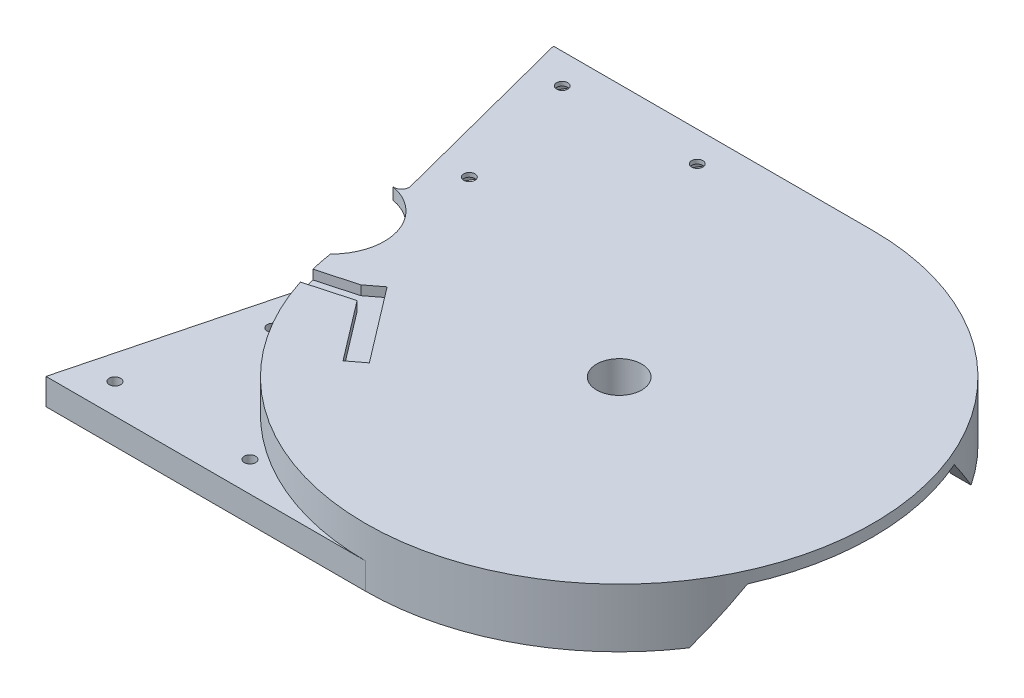
from build123d import *
from build123d.topology import SkipClean

# Parameters (mm, degrees)
SALIENTE_EXTRUIR4_DEPTH      = 8.6
SALIENTE_EXTRUIR2_DEPTH      = 23
CORTAR_EXTRUIR1_DEPTH        = 174.347194959
CORTAR_EXTRUIR1_DEPTH_BACK   = 174.347194959
CROQUIS2_R                   = 14
CROQUIS2_R_2                 = 24
CROQUIS5_R                   = 2.5
CORTAR_EXTRUIR2_DEPTH        = 175.696336539
SALIENTE_EXTRUIR3_START      = -15.6
SALIENTE_EXTRUIR3_DEPTH      = 15.6
CORTAR_EXTRUIR3_DEPTH        = 174.347194959
CORTAR_EXTRUIR3_DEPTH_BACK   = 174.347194959
CROQUIS7_R                   = 6
CORTAR_EXTRUIR4_DEPTH        = 5
CORTAR_EXTRUIR4_DEPTH_BACK   = 12.5
REDONDEO1_R                  = 2
CROQUIS9_R                   = 16.85
CROQUIS9_R_2                 = 6
SALIENTE_EXTRUIR5_DEPTH      = 4.65
CROQUIS10_R                  = 10
CROQUIS10_R_2                = 6
SALIENTE_EXTRUIR6_DEPTH      = 29
REDONDEO2_R                  = 0.5
REDONDEO3_R                  = 2
SALIENTE_EXTRUIR7_REACH      = 177.079
CROQUIS12_R                  = 1.5
CORTAR_EXTRUIR5_DEPTH        = 174.111445318
CORTAR_EXTRUIR6_DEPTH        = 2
CROQUIS14_R                  = 3
CORTAR_EXTRUIR7_DEPTH        = 3.7
CROQUIS15_R                  = 2
CORTAR_EXTRUIR8_DEPTH        = 175.696336539
CROQUIS16_R                  = 4
CORTAR_EXTRUIR9_DEPTH        = 4
CORTAR_EXTRUIR10_DEPTH       = 10
CORTAR_EXTRUIR11_DEPTH       = 2.5
CROQUIS20_W                  = 12
CROQUIS20_H                  = 5
CORTAR_EXTRUIR12_DEPTH       = 176.700917755
REDONDEO4_R                  = 5
CORTAR_EXTRUIR13_START       = -31.6
CORTAR_EXTRUIR13_OUTLINE_W   = 12
CORTAR_EXTRUIR13_OUTLINE_H   = 5
CORTAR_EXTRUIR13_OUTLINE_R   = 2.5
CORTAR_EXTRUIR13_OUTLINE_R_2 = 24
CORTAR_EXTRUIR13_OUTLINE_R_3 = 2
CORTAR_EXTRUIR13_DEPTH       = 31.6
CORTAR_EXTRUIR14_DEPTH       = 8.6
CORTAR_EXTRUIR15_START       = 30
CORTAR_EXTRUIR15_DEPTH       = 83.132388274


# Read off the part's stored shape, not the designer's step: Cortar-Extruir13
with BuildPart() as part:
    # Croquis1 → Saliente-Extruir4 (new body)
    with BuildSketch(Plane(origin=(0, 0, 0), x_dir=(1, 0, 0), z_dir=(0, 1, 0))):
        with BuildLine():
            Line((0, -67.5), (-158, -67.5))
            Line((-158, -67.5), (-158, 67.5))
            Line((-158, 67.5), (0, 67.5))
            ThreePointArc((0, 67.5), (67.5, 0), (0, -67.5))
        make_face()
    extrude(amount=SALIENTE_EXTRUIR4_DEPTH)

    # Croquis3 → Saliente-Extruir2 (add)
    with BuildSketch(Plane.XZ):
        Polygon((-85, -67.5), (-68.148148148, -2.5), (-158, -2.5), (-158, -67.5), align=None)
    extrude(amount=SALIENTE_EXTRUIR2_DEPTH)

    # Croquis2 → Cortar-Extruir1 (cut, two sides: drawn at the far end of the back side and taken through both)
    with BuildSketch(Plane(origin=(0, 0, 0), x_dir=(1, 0, 0), z_dir=(0, 1, 0)).offset(-CORTAR_EXTRUIR1_DEPTH_BACK)):
        with Locations(Location((-76.5, 0, 0), (0, 0, 66.051358792))):
            Circle(CROQUIS2_R)
        with Locations(Location((-121.5, 31, 0), (0, 0, 90))):
            Circle(CROQUIS2_R_2)
        with Locations(Location((-121.5, -31, 0), (0, 0, 90))):
            Circle(CROQUIS2_R_2)
    extrude(amount=CORTAR_EXTRUIR1_DEPTH + CORTAR_EXTRUIR1_DEPTH_BACK, mode=Mode.SUBTRACT)

    # Croquis5 → Cortar-Extruir2 (cut, through all)
    with BuildSketch(Plane(origin=(0, 8.6, 0), x_dir=(1, 0, 0), z_dir=(0, 1, 0))):
        with Locations(Location((-145, -7.5, 0), (0, 0, 270))):
            Circle(CROQUIS5_R)
        with Locations(Location((-145, -54.5, 0), (0, 0, 270))):
            Circle(CROQUIS5_R)
        with Locations(Location((-98, -54.5, 0), (0, 0, 270))):
            Circle(CROQUIS5_R)
        with Locations(Location((-98, -7.5, 0), (0, 0, 270))):
            Circle(CROQUIS5_R)
        with Locations(Location((-145, 7.5, 0), (0, 0, 270))):
            Circle(CROQUIS5_R)
        with Locations(Location((-145, 54.5, 0), (0, 0, 270))):
            Circle(CROQUIS5_R)
    extrude(amount=-CORTAR_EXTRUIR2_DEPTH, mode=Mode.SUBTRACT)

    # Croquis6 → Saliente-Extruir3 (add)
    with BuildSketch(Plane(origin=(0, 8.6, 0), x_dir=(1, 0, 0), z_dir=(0, 1, 0)).offset(SALIENTE_EXTRUIR3_START)):
        with BuildLine():
            Line((0, -67.5), (-85, -67.5))
            Line((-85, -67.5), (-70.817153658, -12.794735536))
            ThreePointArc((-70.817153658, -12.794735536), (-62.5, 0), (-70.817153658, 12.794735536))
            Line((-70.817153658, 12.794735536), (-85, 67.5))
            Line((-85, 67.5), (0, 67.5))
            ThreePointArc((0, 67.5), (67.5, 0), (0, -67.5))
        make_face()
    extrude(amount=SALIENTE_EXTRUIR3_DEPTH)

    # Croquis7 → Cortar-Extruir3 (cut, two sides: drawn at the far end of the back side and taken through both)
    with BuildSketch(Plane(origin=(0, 0, 0), x_dir=(1, 0, 0), z_dir=(0, 1, 0)).offset(-CORTAR_EXTRUIR3_DEPTH_BACK)):
        with Locations(Location((0, 0, 0), (0, 0, 270))):
            Circle(CROQUIS7_R)
    extrude(amount=CORTAR_EXTRUIR3_DEPTH + CORTAR_EXTRUIR3_DEPTH_BACK, mode=Mode.SUBTRACT)

    # Croquis8 → Cortar-Extruir4 (cut, two sides: drawn at the far end of the back side and taken through both)
    with BuildSketch(Plane.XZ.offset(7).offset(-CORTAR_EXTRUIR4_DEPTH_BACK)):
        with BuildLine():
            Line((0, -63), (-116.397014468, -63))
            ThreePointArc((-116.397014468, -63), (-117.923471798, -62.761294784), (-119.304179798, -62.067971208))
            Line((-119.304179798, -62.067971208), (-135.454393581, -50.526261798))
            ThreePointArc((-135.454393581, -50.526261798), (-144.354214963, -23.673004816), (-121.5, -7))
            Line((-121.5, -7), (-95.5, -7))
            ThreePointArc((-95.5, -7), (-91.964466094, -5.535533906), (-90.5, -2))
            Line((-90.5, -2), (-90.5, 0))
            ThreePointArc((-90.5, 0), (-84.130208097, 11.737969347), (-70.817153658, 12.794735536))
            ThreePointArc((-70.817153658, 12.794735536), (-69.810181657, 12.29822469), (-68.84623323, 11.722621474))
            ThreePointArc((-68.84623323, 11.722621474), (-64.266892893, 11.262463458), (-61.251513841, 14.739472589))
            ThreePointArc((-61.251513841, 14.739472589), (49.485284546, 38.989827051), (0, -63))
        make_face()
    extrude(amount=CORTAR_EXTRUIR4_DEPTH + CORTAR_EXTRUIR4_DEPTH_BACK, mode=Mode.SUBTRACT)


with BuildPart() as cortar_extruir4_kept_piece:
    # of the separate pieces the step leaves, the one the design keeps (cortar_extruir4_pieces_kept)
    add(part.part.solids().sort_by_distance((0, 8.6, 67.5))[0])

    # Redondeo1
    redondeo1_edges = [cortar_extruir4_kept_piece.edges().sort_by_distance(p)[0] for p in [
        (-70.817153658, -17.5, -12.794735536),
    ]]
    fillet(redondeo1_edges, radius=REDONDEO1_R)

    # Croquis9 → Saliente-Extruir5 (add)
    with BuildSketch(Plane.XZ.offset(-5.5)):
        with Locations(Location((0, 0, 0), (0, 0, 270))):
            Circle(CROQUIS9_R)
        with Locations(Location((0, 0, 0), (0, 0, 90))):
            Circle(CROQUIS9_R_2, mode=Mode.SUBTRACT)
    extrude(amount=SALIENTE_EXTRUIR5_DEPTH)

    # Croquis10 → Saliente-Extruir6 (add)
    with BuildSketch(Plane.XZ.offset(-0.85)):
        with Locations(Location((0, 0, 0), (0, 0, 90))):
            Circle(CROQUIS10_R)
        with Locations(Location((0, 0, 0), (0, 0, 90))):
            Circle(CROQUIS10_R_2, mode=Mode.SUBTRACT)
    extrude(amount=SALIENTE_EXTRUIR6_DEPTH)

    # Redondeo2
    redondeo2_edges = [cortar_extruir4_kept_piece.edges().sort_by_distance(p)[0] for p in [
        (0, 0.85, 16.85),
    ]]
    fillet(redondeo2_edges, radius=REDONDEO2_R)

    # Redondeo3
    redondeo3_edges = [cortar_extruir4_kept_piece.edges().sort_by_distance(p)[0] for p in [
        (0, 5.5, 16.85),
    ]]
    fillet(redondeo3_edges, radius=REDONDEO3_R)

    # Croquis11 → Saliente-Extruir7 (add, up to next)
    with BuildSketch(Plane.XZ.offset(-5.5), mode=Mode.PRIVATE) as saliente_extruir7_sk1:
        with BuildLine():
            Line((-73.203703704, -22), (-77.87037037, -40))
            Line((-77.87037037, -40), (-99.251404539, -40))
            ThreePointArc((-99.251404539, -40), (-97.5, -31), (-99.251404539, -22))
            Line((-99.251404539, -22), (-73.203703704, -22))
        make_face()
    saliente_extruir7_tool1 = extrude(saliente_extruir7_sk1.sketch, amount=SALIENTE_EXTRUIR7_REACH, mode=Mode.PRIVATE) - cortar_extruir4_kept_piece.part
    add(saliente_extruir7_tool1.solids().sort_by_distance((-86.771742, 5.5, -30.689413))[0])

    # Croquis12 → Cortar-Extruir5 (cut, through all)
    with BuildSketch(Plane.XZ.offset(7)):
        with Locations(Location((-74.661436633, 59.5, 0), (0, 0, 270))):
            Circle(CROQUIS12_R)
        with Locations(Location((-66.012679429, 26.140507926, 0), (0, 0, 270))):
            Circle(CROQUIS12_R)
        with Locations(Location((-38.73951471, 59.5, 0), (0, 0, 270))):
            Circle(CROQUIS12_R)
        with Locations(Location((-38.73951471, -59.5, 0), (0, 0, 270))):
            Circle(CROQUIS12_R)
        with Locations(Location((-74.661436633, -59.5, 0), (0, 0, 270))):
            Circle(CROQUIS12_R)
        with Locations(Location((-66.012679429, -26.140507926, 0), (0, 0, 270))):
            Circle(CROQUIS12_R)
    extrude(amount=-CORTAR_EXTRUIR5_DEPTH, mode=Mode.SUBTRACT)

    # Croquis13 → Cortar-Extruir6 (cut)
    with BuildSketch(Plane.XZ.offset(-5.5)):
        Polygon((-70.908659884, -59.5), (-72.785048259, -56.25), (-76.537825008, -56.25), (-78.414213383, -59.5), (-76.537825008, -62.75), (-72.785048259, -62.75), align=None)
        Polygon((-62.259902679, -26.140507926), (-64.136291054, -22.890507926), (-67.889067804, -22.890507926), (-69.765456179, -26.140507926), (-67.889067804, -29.390507926), (-64.136291054, -29.390507926), align=None)
        Polygon((-34.986737961, -59.5), (-36.863126336, -56.25), (-40.615903085, -56.25), (-42.49229146, -59.5), (-40.615903085, -62.75), (-36.863126336, -62.75), align=None)
    extrude(amount=-CORTAR_EXTRUIR6_DEPTH, mode=Mode.SUBTRACT)

    # Croquis14 → Cortar-Extruir7 (cut)
    with BuildSketch(Plane.XZ.offset(7)):
        with Locations(Location((-66.012679429, 26.140507926, 0), (0, 0, 270))):
            Circle(CROQUIS14_R)
        with Locations(Location((-74.661436633, 59.5, 0), (0, 0, 270))):
            Circle(CROQUIS14_R)
        with Locations(Location((-38.73951471, 59.5, 0), (0, 0, 270))):
            Circle(CROQUIS14_R)
    extrude(amount=-CORTAR_EXTRUIR7_DEPTH, mode=Mode.SUBTRACT)

    # Croquis15 → Cortar-Extruir8 (cut, through all)
    with BuildSketch(Plane.XZ.offset(23)):
        with Locations(Location((-86.518518519, -31, 0), (0, 0, 270))):
            Circle(CROQUIS15_R)
        with Locations(Location((-86.518518519, 31, 0), (0, 0, 90))):
            Circle(CROQUIS15_R)
    extrude(amount=-CORTAR_EXTRUIR8_DEPTH, mode=Mode.SUBTRACT)

    # Croquis16 → Cortar-Extruir9 (cut)
    with BuildSketch(Plane.XZ):
        with Locations(Location((-86.518518519, 31, 0), (0, 0, 270))):
            Circle(CROQUIS16_R)
    extrude(amount=-CORTAR_EXTRUIR9_DEPTH, mode=Mode.SUBTRACT)

    # Croquis17 → Cortar-Extruir10 (cut)
    with BuildSketch(Plane.XZ.offset(23)):
        Polygon((-82.1883915, -31), (-84.353455009, -27.25), (-88.683582028, -27.25), (-90.848645537, -31), (-88.683582028, -34.75), (-84.353455009, -34.75), align=None)
    extrude(amount=-CORTAR_EXTRUIR10_DEPTH, mode=Mode.SUBTRACT)

    # Croquis19 → Cortar-Extruir11 (cut)
    with BuildSketch(Plane(origin=(0, 8.6, 0), x_dir=(1, 0, 0), z_dir=(0, 1, 0))):
        Polygon((-52.482988664, -17.255771853), (-40.471682692, -33.003928572), (-36.496071428, -29.971682692), (-51.657300826, -10.09362637), (-55.63291209, -13.12587225), (-80.518518519, -20), (-92.518518519, -20), (-92.518518519, -25), (-80.518518519, -25), align=None)
    extrude(amount=-CORTAR_EXTRUIR11_DEPTH, mode=Mode.SUBTRACT)

    # Croquis20 → Cortar-Extruir12 (cut, through all)
    with BuildSketch(Plane(origin=(0, 8.6, 0), x_dir=(1, 0, 0), z_dir=(0, 1, 0))):
        with Locations((-86.518518519, -22.5)):
            Rectangle(CROQUIS20_W, CROQUIS20_H)
    extrude(amount=-CORTAR_EXTRUIR12_DEPTH, mode=Mode.SUBTRACT)

    # Redondeo4
    # the kernel refuses this fillet: 5 mm, written as the material it takes off along each edge
    with BuildSketch(Plane(origin=(-80.518518519, 6.1, 25), x_dir=(0, -1, 0), z_dir=(0, 0, -1))) as redondeo4_piece_1_section:
        with BuildLine():
            CenterArc((REDONDEO4_R, -REDONDEO4_R), REDONDEO4_R, 90, 90)
            Line((0, -REDONDEO4_R), (0, 0))
            Line((0, 0), (REDONDEO4_R, 0))
        make_face()
    redondeo4_piece_1 = extrude(amount=5, mode=Mode.PRIVATE)
    redondeo4_piece_1 = split(redondeo4_piece_1, bisect_by=Plane(origin=(-78.850583618, 4.928175606, 24.539267905), z_dir=(-0.26625771274306737, 0, -0.9639018779963188)), keep=Keep.TOP, mode=Mode.PRIVATE)
    redondeo4_piece_1 = split(redondeo4_piece_1, bisect_by=Plane(origin=(-80.133815165, 4.928175606, 19.893733753), z_dir=(0.2662577127430677, 0, 0.9639018779963188)), keep=Keep.TOP, mode=Mode.PRIVATE)
    add(redondeo4_piece_1, mode=Mode.SUBTRACT)
    with BuildSketch(Plane(origin=(-80.518518519, 6.1, 25), x_dir=(0, -1, 0), z_dir=(0, 0, -1))) as redondeo4_piece_2_section:
        with BuildLine():
            CenterArc((REDONDEO4_R, -REDONDEO4_R), REDONDEO4_R, 90, 90)
            Line((0, -REDONDEO4_R), (0, 0))
            Line((0, 0), (REDONDEO4_R, 0))
        make_face()
    redondeo4_piece_2 = extrude(amount=17.5, mode=Mode.PRIVATE)
    redondeo4_piece_2 = split(redondeo4_piece_2, bisect_by=Plane(origin=(-78.44415934, 5.567637436, 19.427001708), z_dir=(0.2662577127430677, 0, 0.9639018779963188)), keep=Keep.TOP, mode=Mode.PRIVATE)
    redondeo4_piece_2 = split(redondeo4_piece_2, bisect_by=Plane(origin=(-78.36792826, 5.567637436, 20), z_dir=(0, 0, -1)), keep=Keep.TOP, mode=Mode.PRIVATE)
    add(redondeo4_piece_2, mode=Mode.SUBTRACT)

    # Cortar-Extruir13 outline → Cortar-Extruir13 (cut)
    with BuildSketch(Plane(origin=(0, 8.6, 0), x_dir=(1, 0, 0), z_dir=(0, 1, 0)).offset(CORTAR_EXTRUIR13_START)):
        with BuildLine():
            ThreePointArc((-70.817153658, -12.794735537), (-85.151755874, -11.006685255), (-90.274977314, 2.5))
            ThreePointArc((-90.274977314, 2.5), (-84.474430695, 11.506887289), (-74.004352038, 13.775766449))
            ThreePointArc((-74.004352038, 13.775766449), (-72.181961261, 14.383135348), (-71.711837104, 16.245657402))
            Line((-71.711837104, 16.245657402), (-73.203703704, 22))
            Line((-73.203703704, 22), (-77.87037037, 40))
            Line((-77.87037037, 40), (-83.833333333, 63))
            Line((-83.833333333, 63), (-85, 67.5))
            Line((-85, 67.5), (-158, 67.5))
            Line((-158, 67.5), (-158, -67.5))
            Line((-158, -67.5), (-85, -67.5))
            Line((-85, -67.5), (-70.817153658, -12.794735537))
        make_face()
        with Locations((-86.518518519, -22.5)):
            Rectangle(CORTAR_EXTRUIR13_OUTLINE_W, CORTAR_EXTRUIR13_OUTLINE_H, mode=Mode.SUBTRACT)
        with Locations((-145, -54.5)):
            Circle(CORTAR_EXTRUIR13_OUTLINE_R, mode=Mode.SUBTRACT)
        with Locations((-145, -7.5)):
            Circle(CORTAR_EXTRUIR13_OUTLINE_R, mode=Mode.SUBTRACT)
        with Locations((-121.5, -31)):
            Circle(CORTAR_EXTRUIR13_OUTLINE_R_2, mode=Mode.SUBTRACT)
        with Locations((-98, -54.5)):
            Circle(CORTAR_EXTRUIR13_OUTLINE_R, mode=Mode.SUBTRACT)
        with Locations((-98, -7.5)):
            Circle(CORTAR_EXTRUIR13_OUTLINE_R, mode=Mode.SUBTRACT)
        with Locations((-145, 54.5)):
            Circle(CORTAR_EXTRUIR13_OUTLINE_R, mode=Mode.SUBTRACT)
        with Locations((-121.5, 31)):
            Circle(CORTAR_EXTRUIR13_OUTLINE_R_2, mode=Mode.SUBTRACT)
        with Locations((-145, 7.5)):
            Circle(CORTAR_EXTRUIR13_OUTLINE_R, mode=Mode.SUBTRACT)
        with Locations((-86.518518519, -31)):
            Circle(CORTAR_EXTRUIR13_OUTLINE_R_3, mode=Mode.SUBTRACT)
        with Locations((-86.518518519, 31)):
            Circle(CORTAR_EXTRUIR13_OUTLINE_R_3, mode=Mode.SUBTRACT)
    extrude(amount=CORTAR_EXTRUIR13_DEPTH, mode=Mode.SUBTRACT)

    # Croquis22 → Cortar-Extruir14 (cut)
    with SkipClean():  # the faces are left unmerged after this step: merging them gives an invalid solid
        with BuildSketch(Plane(origin=(0, 8.6, 0), x_dir=(1, 0, 0), z_dir=(0, 1, 0))):
            with BuildLine():
                Line((-85, -67.5), (-67.5, 0))
                ThreePointArc((-67.5, 0), (-47.72970773, -47.72970773), (0, -67.5))
                Line((0, -67.5), (-85, -67.5))
            make_face()
        extrude(amount=-CORTAR_EXTRUIR14_DEPTH, mode=Mode.SUBTRACT)

    # Croquis23 → Cortar-Extruir15 (cut, through all)
    with SkipClean():  # the faces are left unmerged after this step: merging them gives an invalid solid
        with BuildSketch(Plane(origin=(0, 0, 0), x_dir=(0, 0, -1), z_dir=(1, 0, 0)).offset(CORTAR_EXTRUIR15_START)):
            Polygon((-37.5, -7), (-27.5, 5.5), (27.5, 5.5), (37.5, -7), align=None)
        extrude(amount=CORTAR_EXTRUIR15_DEPTH, mode=Mode.SUBTRACT)


solid = cortar_extruir4_kept_piece.part
